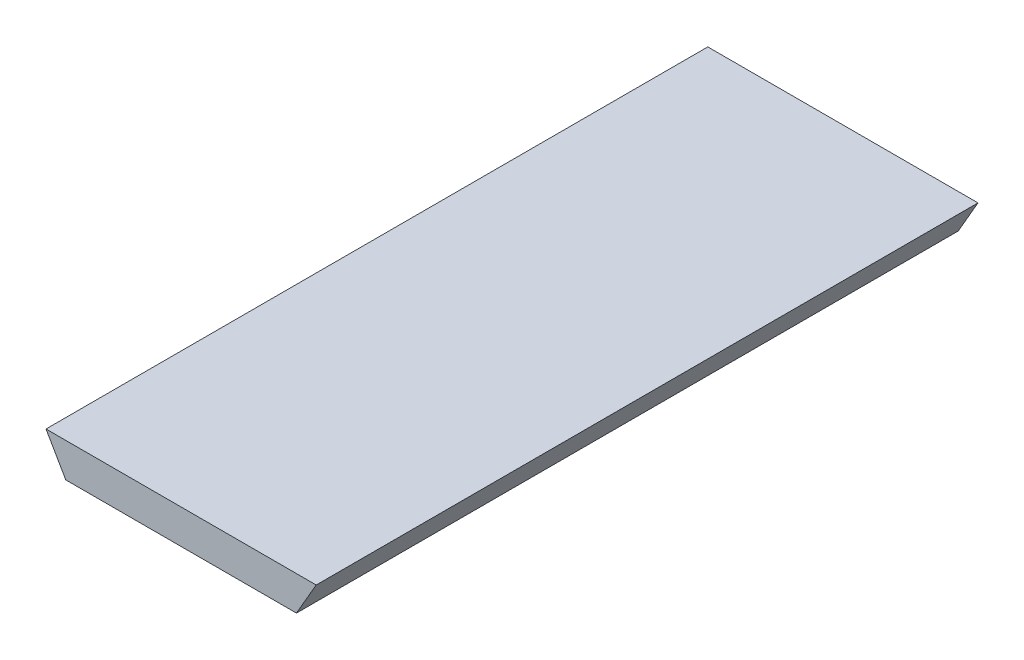
from build123d import *

# Parameters (mm, degrees)
BOSS_EXTRU_1_DEPTH = 580


with BuildPart() as part:
    # Esquisse1 → Boss.-Extru.1 (new body)
    with BuildSketch(Plane.XY):
        Polygon((219.489145899, 0), (236.807621582, 30), (0, 30), (17.318475684, 0), align=None)
    extrude(amount=BOSS_EXTRU_1_DEPTH)


solid = part.part
